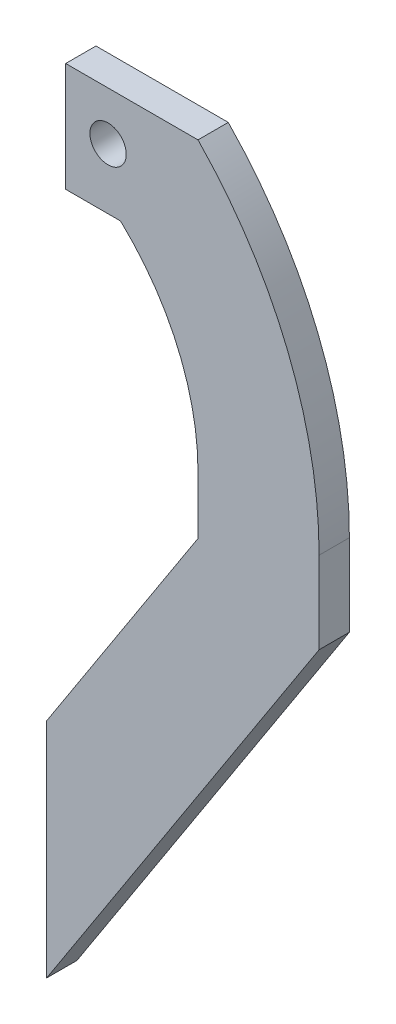
from build123d import *

# Parameters (mm, degrees)
SKETCH1_R           = 3
BOSS_EXTRUDE1_DEPTH = 5


with BuildPart() as part:
    # Sketch1 → Boss-Extrude1 (new body)
    with BuildSketch(Plane.XY):
        with BuildLine():
            Line((10.147551644, -29.873187436), (31.997626327, -29.873187436))
            ThreePointArc((31.997626327, -29.873187436), (46.807955944, -52.623423024), (51.997626327, -79.268993088))
            Line((51.997626327, -79.268993088), (51.997626327, -92.791521134))
            Line((51.997626327, -92.791521134), (6.997626327, -162.240781742))
            Line((6.997626327, -162.240781742), (6.997626327, -125.46129256))
            Line((6.997626327, -125.46129256), (31.997626327, -86.87837))
            Line((31.997626327, -86.87837), (31.997626327, -77.316036189))
            ThreePointArc((31.997626327, -77.316036189), (28.660716715, -61.264672397), (19.202948696, -47.873187436))
            Line((19.202948696, -47.873187436), (10.147551644, -47.873187436))
            Line((10.147551644, -47.873187436), (10.147551644, -29.873187436))
        make_face()
        with Locations((17.147551644, -37.873187436)):
            Circle(SKETCH1_R, mode=Mode.SUBTRACT)
    extrude(amount=BOSS_EXTRUDE1_DEPTH)


solid = part.part
